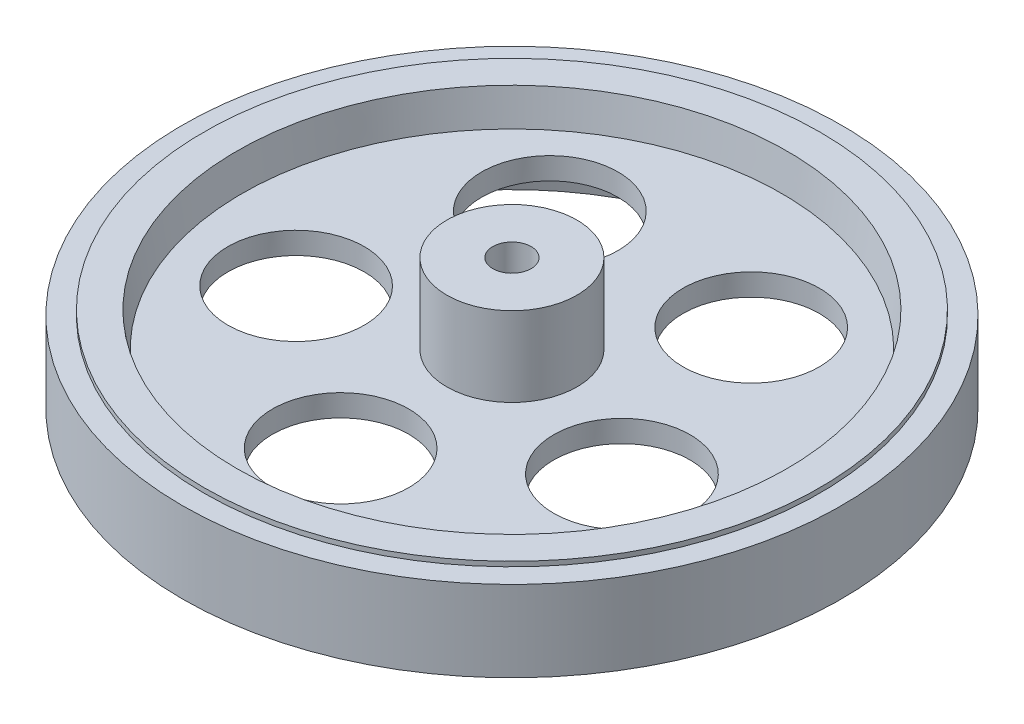
from build123d import *

# Parameters (mm, degrees)
SKETCH1_R           = 48.1
BOSS_EXTRUDE2_DEPTH = 5.9
SKETCH2_R           = 44.95
BOSS_EXTRUDE3_DEPTH = 0.7
SKETCH5_R           = 40.15
CUT_EXTRUDE1_DEPTH  = 5
SKETCH8_R           = 9.95
CUT_EXTRUDE2_DEPTH  = 69.516129488
SKETCH8_4_R         = 9.5
BOSS_EXTRUDE4_DEPTH = 11.6
SKETCH9_R           = 8.5
SKETCH10_R          = 7.95
CUT_EXTRUDE3_REACH  = 72.847
SKETCH11_R          = 2.8


# Read off the part's stored shape, not the designer's step: Loft2, Loft3
with BuildPart() as part:
    # Sketch1 → Boss-Extrude2 (new body)
    with BuildSketch(Plane(origin=(0, 0, 0), x_dir=(1, 0, 0), z_dir=(0, 1, 0))):
        with Locations(Location((0, 0, 0), (0, 0, 270))):
            Circle(SKETCH1_R)
    boss_extrude2 = extrude(amount=BOSS_EXTRUDE2_DEPTH)

    # Sketch2 → Boss-Extrude3 (add)
    with BuildSketch(Plane(origin=(0, 5.9, 0), x_dir=(1, 0, 0), z_dir=(0, 1, 0))):
        with Locations(Location((0, 0, 0), (0, 0, 270))):
            Circle(SKETCH2_R)
    boss_extrude3 = extrude(amount=BOSS_EXTRUDE3_DEPTH)

    # Sketch5 → Cut-Extrude1 (cut)
    with BuildSketch(Plane(origin=(0, 6.6, 0), x_dir=(1, 0, 0), z_dir=(0, 1, 0))):
        with Locations(Location((0, 0, 0), (0, 0, 270))):
            Circle(SKETCH5_R)
    cut_extrude1 = extrude(amount=-CUT_EXTRUDE1_DEPTH, mode=Mode.SUBTRACT)

    # Loft2 outline → Loft2 (revolve)
    with BuildSketch(Plane.XY):
        Polygon((40.15, 6.6), (39.4, 1.6), (40.15, 1.6), align=None)
    revolve(axis=Axis((0, 0, 0), (0, 1, 0)))

    # Mirror2: Boss-Extrude2, Boss-Extrude3, Cut-Extrude1 across Top Plane
    add(boss_extrude2.mirror(Plane(origin=(0, 0, 0), x_dir=(1, 0, 0), z_dir=(0, 1, 0))))
    add(boss_extrude3.mirror(Plane(origin=(0, 0, 0), x_dir=(1, 0, 0), z_dir=(0, 1, 0))))
    add(cut_extrude1.mirror(Plane(origin=(0, 0, 0), x_dir=(1, 0, 0), z_dir=(0, 1, 0))), mode=Mode.SUBTRACT)

    # Loft3 outline → Loft3 (revolve)
    with BuildSketch(Plane.XY):
        Polygon((40.15, -1.6), (39.4, -1.6), (40.15, -6.6), align=None)
    revolve(axis=Axis((0, 0, 0), (0, 1, 0)))

    # Sketch8 → Cut-Extrude2 (cut, through all)
    with BuildSketch(Plane(origin=(0, 1.6, 0), x_dir=(1, 0, 0), z_dir=(0, 1, 0))):
        with Locations(Location((0, -25, 0), (0, 0, 270))):
            Circle(SKETCH8_R)
        with Locations(Location((-23.776412907, -7.725424859, 0), (0, 0, 270))):
            Circle(SKETCH8_R)
        with Locations(Location((-14.694631307, 20.225424859, 0), (0, 0, 270))):
            Circle(SKETCH8_R)
        with Locations(Location((14.694631307, 20.225424859, 0), (0, 0, 270))):
            Circle(SKETCH8_R)
        with Locations(Location((23.776412907, -7.725424859, 0), (0, 0, 270))):
            Circle(SKETCH8_R)
    extrude(amount=-CUT_EXTRUDE2_DEPTH, mode=Mode.SUBTRACT)

    # Sketch8<4> → Boss-Extrude4 (add)
    with BuildSketch(Plane(origin=(0, 1.6, 0), x_dir=(1, 0, 0), z_dir=(0, 1, 0))):
        with Locations(Location((0, 0, 0), (0, 0, 270))):
            Circle(SKETCH8_4_R)
    extrude(amount=BOSS_EXTRUDE4_DEPTH)

    # Sketch9 → Loft4 section 0
    with BuildSketch(Plane.XZ.offset(1.6)):
        Circle(SKETCH9_R)
    # Sketch10 → Loft4 section 1
    with BuildSketch(Plane(origin=(0, -6, 0), x_dir=(-1, 0, 0), z_dir=(0, -1, 0))):
        Circle(SKETCH10_R)
    loft()

    # Sketch11 → Cut-Extrude3 (cut, up to next)
    with BuildSketch(Plane(origin=(0, 13.2, 0), x_dir=(1, 0, 0), z_dir=(0, 1, 0)), mode=Mode.PRIVATE) as cut_extrude3_sk1:
        with Locations(Location((0, 0, 0), (0, 0, 270))):
            Circle(SKETCH11_R)
    cut_extrude3_tool1 = extrude(cut_extrude3_sk1.sketch, amount=-CUT_EXTRUDE3_REACH, mode=Mode.PRIVATE) & part.part
    add(cut_extrude3_tool1.solids().sort_by_distance((0, 13.2, 0))[0], mode=Mode.SUBTRACT)


solid = part.part
